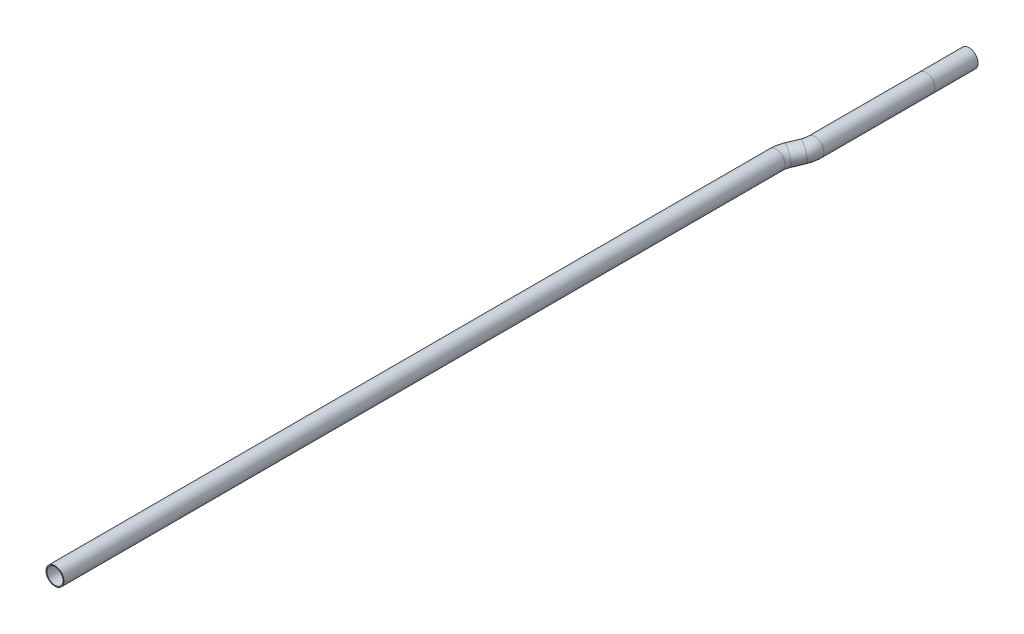
from build123d import *

# Parameters (mm, degrees)
SKETCH1_R   = 3.175
SKETCH1_R_2 = 2.8575


with BuildPart() as part:
    # Sweep1: sweep along a path in Sketch2
    with BuildLine(Plane(origin=(0, 0, 0), x_dir=(0, 0, 1), z_dir=(-0.1950903220161292, 0.9807852804032303, 0))) as sweep1_path:
        Line((-12.7, 3.81), (0, 3.81))
        Line((0, 3.81), (2.54, 3.81))
        Line((2.54, 3.81), (41.813145346, 3.81))
        ThreePointArc((41.813145346, 3.81), (43.456646283, 3.593628997), (44.988145346, 2.959261314))
        Line((44.988145346, 2.959261314), (48.640213667, 0.850738686))
        ThreePointArc((48.640213667, 0.850738686), (50.17171273, 0.216371003), (51.815213667, 0))
        Line((51.815213667, 0), (307.085213667, 0))
    # Sketch1 → Sweep1 (sweep)
    with BuildSketch(Plane.XY):
        with Locations((3.736791918, 0.743294127)):
            Circle(SKETCH1_R)
        with Locations((3.736791918, 0.743294127)):
            Circle(SKETCH1_R_2, mode=Mode.SUBTRACT)
    sweep(path=sweep1_path.line)


solid = part.part
